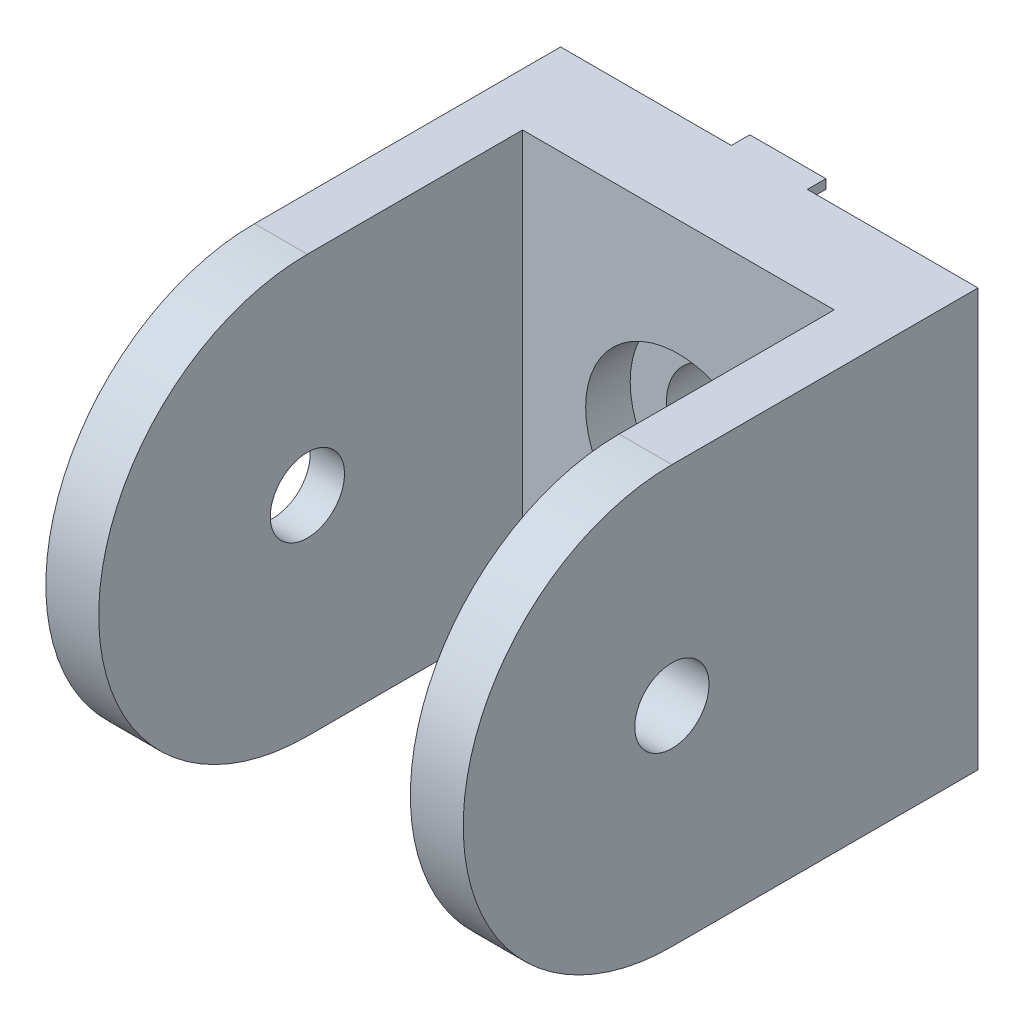
from build123d import *

# Parameters (mm, degrees)
SKETCH_1_W          = 45
SKETCH_1_H          = 45
EXTRUDE_1_DEPTH     = 9.8
SKETCH_2_W          = 5.7
SKETCH_2_H          = 45
EXTRUDE_2_DEPTH     = 45.7
CUT_EXTRUDE_START   = -45
CUT_EXTRUDE_2_DEPTH = 45
SKETCH_4_R          = 4
CUT_EXTRUDE_3_DEPTH = 75.909945935
SKETCH_5_R          = 8
CUT_EXTRUDE_4_DEPTH = 2
SKETCH_6_R          = 6.1
CUT_EXTRUDE_5_DEPTH = 56.686533381
SKETCH_7_W          = 8.2
SKETCH_7_H          = 1
EXTRUDE_3_DEPTH     = 2
SKETCH_8_R          = 10
CUT_EXTRUDE_6_DEPTH = 4.8


# Read off the part's stored shape, not the designer's step: 切除-拉伸2
with BuildPart() as part:
    # 草图1 → 凸台-拉伸1 (new body)
    with BuildSketch(Plane.XY):
        Rectangle(SKETCH_1_W, SKETCH_1_H)
    extrude(amount=EXTRUDE_1_DEPTH)

    # 草图2 → 凸台-拉伸2 (add)
    with BuildSketch(Plane.XY.offset(9.8)):
        with Locations((-19.65, 0)):
            Rectangle(SKETCH_2_W, SKETCH_2_H)
        with Locations((19.65, 0)):
            Rectangle(SKETCH_2_W, SKETCH_2_H)
    extrude(amount=EXTRUDE_2_DEPTH)

    # 切除-拉伸2 outline → 切除-拉伸2 (cut)
    with BuildSketch(Plane.ZY.offset(22.5).offset(CUT_EXTRUDE_START)):
        with BuildLine():
            Line((55.5, 22.5), (33, 22.5))
            ThreePointArc((33, 22.5), (48.909902577, 15.909902577), (55.5, 0))
            Line((55.5, 0), (55.5, 22.5))
        make_face()
        with BuildLine():
            Line((55.5, -22.5), (55.5, 0))
            ThreePointArc((55.5, 0), (48.909902577, -15.909902577), (33, -22.5))
            Line((33, -22.5), (55.5, -22.5))
        make_face()
    extrude(amount=CUT_EXTRUDE_2_DEPTH, mode=Mode.SUBTRACT)

    # 草图4 → 切除-拉伸3 (cut, through all)
    with BuildSketch(Plane.ZY.offset(22.5)):
        with Locations((33, 0)):
            Circle(SKETCH_4_R)
    extrude(amount=-CUT_EXTRUDE_3_DEPTH, mode=Mode.SUBTRACT)

    # 草图5 → 切除-拉伸4 (cut)
    with BuildSketch(Plane.ZY.offset(22.5)):
        with Locations((33, 0)):
            Circle(SKETCH_5_R)
    extrude(amount=-CUT_EXTRUDE_4_DEPTH, mode=Mode.SUBTRACT)

    # 草图6 → 切除-拉伸5 (cut, through all)
    with BuildSketch(Plane.XY.offset(9.8)):
        Circle(SKETCH_6_R)
    extrude(amount=-CUT_EXTRUDE_5_DEPTH, mode=Mode.SUBTRACT)

    # 草图7 → 凸台-拉伸3 (add)
    with BuildSketch(Plane(origin=(0, 0, 0), x_dir=(-1, 0, 0), z_dir=(0, 0, -1))):
        with Locations((0, 22)):
            Rectangle(SKETCH_7_W, SKETCH_7_H)
        with Locations((0, -22)):
            Rectangle(SKETCH_7_W, SKETCH_7_H)
    extrude(amount=EXTRUDE_3_DEPTH)

    # 草图8 → 切除-拉伸6 (cut)
    with BuildSketch(Plane.XY.offset(9.8)):
        Circle(SKETCH_8_R)
    extrude(amount=-CUT_EXTRUDE_6_DEPTH, mode=Mode.SUBTRACT)


solid = part.part
